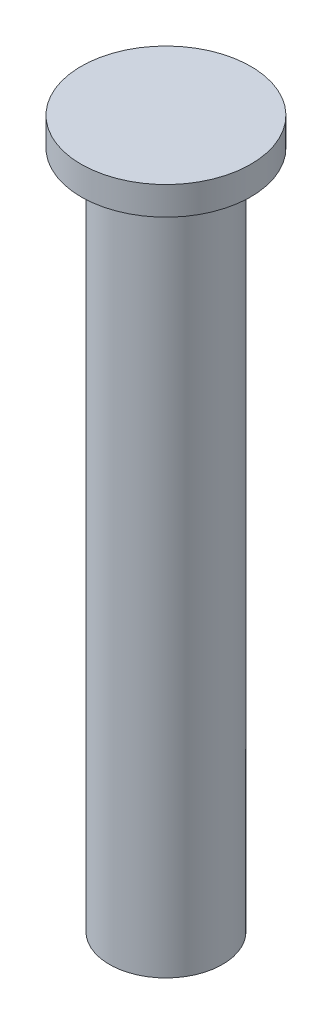
from build123d import *

# Parameters (mm, degrees)
SKETCH_1_R      = 10
EXTRUDE_1_DEPTH = 120
SKETCH_2_R      = 15
EXTRUDE_2_DEPTH = 5


with BuildPart() as part:
    # Эскиз1 → Бобышка-Вытянуть1 (new body)
    with BuildSketch(Plane(origin=(0, 0, 0), x_dir=(1, 0, 0), z_dir=(0, 1, 0))):
        Circle(SKETCH_1_R)
    extrude(amount=EXTRUDE_1_DEPTH)

    # Эскиз2 → Бобышка-Вытянуть2 (add)
    with BuildSketch(Plane(origin=(0, 120, 0), x_dir=(1, 0, 0), z_dir=(0, 1, 0))):
        Circle(SKETCH_2_R)
    extrude(amount=EXTRUDE_2_DEPTH)


solid = part.part
